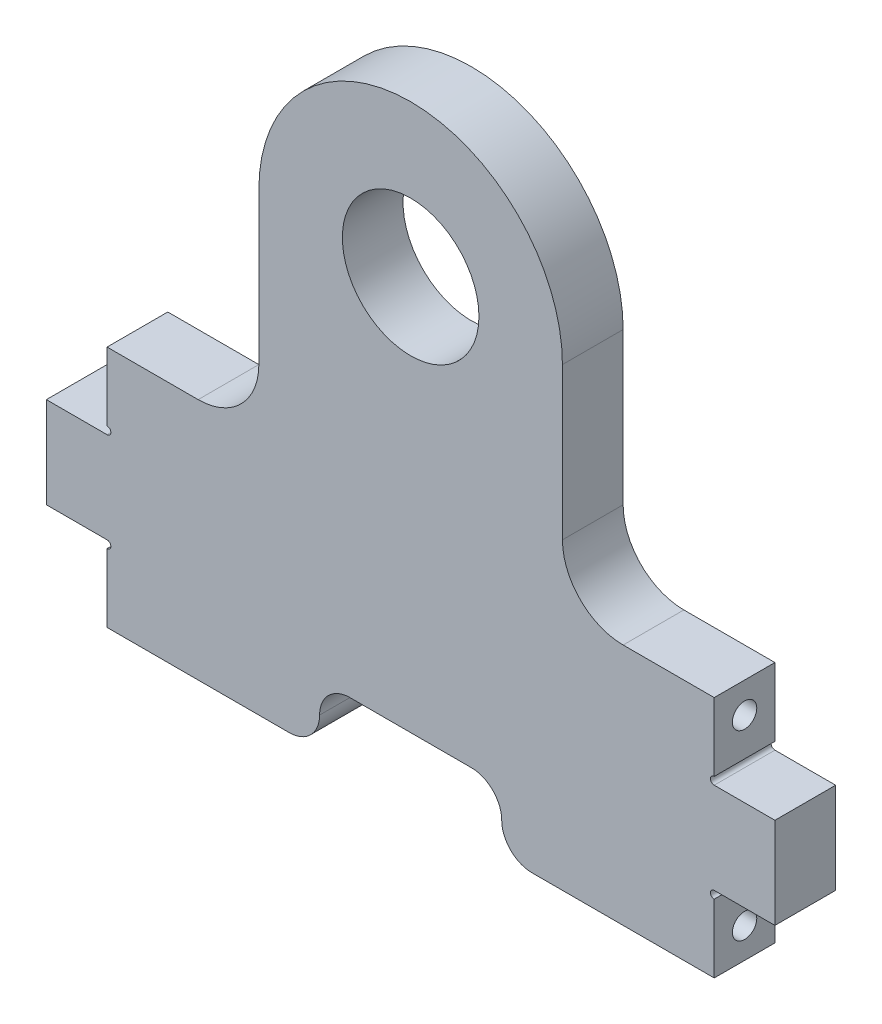
from build123d import *

# Parameters (mm, degrees)
SKETCH1_W                        = 127
SKETCH1_H                        = 152.4
BOSS_EXTRUDE1_DEPTH              = 12.7
SKETCH2_R                        = 14.2875
CUT_EXTRUDE1_DEPTH               = 166.587741092
FILLET1_R                        = 12.7
F_1_4_20_TAPPED_HOLE1_AT_2_COUNT = 2
F_1_4_20_TAPPED_HOLE1_AT_2_PITCH = 38.1
SKETCH5_W                        = 12.7
SKETCH5_H                        = 19.05
BOSS_EXTRUDE2_DEPTH              = 12.7
SKETCH6_R                        = 0.79375
CUT_EXTRUDE2_DEPTH               = 149.649688866
SKETCH7_W                        = 38.1
SKETCH7_H                        = 12.7
CUT_EXTRUDE3_DEPTH               = 149.649688866
FILLET2_START                    = -1
FILLET2_DEPTH                    = 15
FILLET2_2_DEPTH                  = 12.7


with BuildPart() as part:
    # Sketch1 → Boss-Extrude1 (new body)
    with BuildSketch(Plane.XY):
        with Locations((0, 76.2)):
            Rectangle(SKETCH1_W, SKETCH1_H)
    extrude(amount=BOSS_EXTRUDE1_DEPTH)

    # Sketch2 → Cut-Extrude1 (cut, through all)
    with BuildSketch(Plane.XY.offset(12.7)):
        with Locations((0, 95.25)):
            Circle(SKETCH2_R)
        with BuildLine():
            Line((31.75, 95.25), (31.75, 50.8))
            Line((31.75, 50.8), (63.5, 50.8))
            Line((63.5, 50.8), (63.5, 152.4))
            Line((63.5, 152.4), (-63.5, 152.4))
            Line((-63.5, 152.4), (-63.5, 50.8))
            Line((-63.5, 50.8), (-31.75, 50.8))
            Line((-31.75, 50.8), (-31.75, 95.25))
            ThreePointArc((-31.75, 95.25), (0, 127), (31.75, 95.25))
        make_face()
    extrude(amount=-CUT_EXTRUDE1_DEPTH, mode=Mode.SUBTRACT)

    # Fillet1
    fillet1_edges = [part.edges().sort_by_distance(p)[0] for p in [
        (-31.75, 50.8, 6.35),
        (31.75, 50.8, 6.35),
    ]]
    fillet(fillet1_edges, radius=FILLET1_R)

    # Sketch3 → 1/4-20 Tapped Hole1 (revolve, cut)
    with BuildSketch(Plane(origin=(63.5, 44.45, 6.35), x_dir=(0, 0, -1), z_dir=(0, 1, 0))):
        Polygon((0, 0), (0, 18.043816902), (2.5527, 16.51), (2.5527, 0), align=None)
    f_1_4_20_tapped_hole1 = revolve(axis=Axis((69.85, 44.45, 6.35), (-1, 0, 0)), mode=Mode.SUBTRACT)

    # 1/4-20 Tapped Hole1 at 2: 1/4-20 Tapped Hole1 ×2
    with Locations(*[(0, -i * F_1_4_20_TAPPED_HOLE1_AT_2_PITCH, 0) for i in range(1, F_1_4_20_TAPPED_HOLE1_AT_2_COUNT)]):
        add(f_1_4_20_tapped_hole1, mode=Mode.SUBTRACT)

    # Sketch5 → Boss-Extrude2 (add)
    with BuildSketch(Plane(origin=(63.5, 0, 0), x_dir=(0, 0, -1), z_dir=(1, 0, 0))):
        with Locations((-6.35, 25.4)):
            Rectangle(SKETCH5_W, SKETCH5_H)
    boss_extrude2 = extrude(amount=BOSS_EXTRUDE2_DEPTH)

    # Sketch6 → Cut-Extrude2 (cut, through all)
    with BuildSketch(Plane.XY.offset(12.7)):
        with Locations((63.5, 35.71875)):
            Circle(SKETCH6_R)
        with Locations((63.5, 15.08125)):
            Circle(SKETCH6_R)
    cut_extrude2 = extrude(amount=-CUT_EXTRUDE2_DEPTH, mode=Mode.SUBTRACT)

    # Mirror1: 1/4-20 Tapped Hole1, Boss-Extrude2, Cut-Extrude2 across plane
    add(f_1_4_20_tapped_hole1.mirror(Plane(origin=(0, 0, 0), x_dir=(0, 0, 1), z_dir=(1, 0, 0))), mode=Mode.SUBTRACT)
    add(boss_extrude2.mirror(Plane(origin=(0, 0, 0), x_dir=(0, 0, 1), z_dir=(1, 0, 0))))
    add(cut_extrude2.mirror(Plane(origin=(0, 0, 0), x_dir=(0, 0, 1), z_dir=(1, 0, 0))), mode=Mode.SUBTRACT)

    # Mirror1 copy 1 sketch → Mirror1 copy 1 (revolve, cut)
    with BuildSketch(Plane(origin=(-63.5, 6.35, 6.35), x_dir=(0, 0, -1), z_dir=(0, 1, 0))):
        Polygon((0, 0), (0, -18.043816902), (2.5527, -16.51), (2.5527, 0), align=None)
    revolve(axis=Axis((-69.85, 6.35, 6.35), (-1, 0, 0)), mode=Mode.SUBTRACT)

    # Sketch7 → Cut-Extrude3 (cut, through all)
    with BuildSketch(Plane.XY.offset(12.7)):
        with Locations((0, 6.35)):
            Rectangle(SKETCH7_W, SKETCH7_H)
    extrude(amount=-CUT_EXTRUDE3_DEPTH, mode=Mode.SUBTRACT)

    # Fillet2: read off the stored shape, not the designer's step
    # Fillet2 outline → Fillet2 (cut)
    with BuildSketch(Plane.XY.offset(FILLET2_START)):
        with BuildLine():
            Line((19.05, 0), (25.4, 0))
            ThreePointArc((25.4, 0), (20.909871939, 1.859871939), (19.05, 6.35))
            Line((19.05, 6.35), (19.05, 0))
        make_face()
        with BuildLine():
            Line((-19.05, 0), (-19.05, 6.35))
            ThreePointArc((-19.05, 6.35), (-20.909871939, 1.859871939), (-25.4, 0))
            Line((-25.4, 0), (-19.05, 0))
        make_face()
    extrude(amount=FILLET2_DEPTH, mode=Mode.SUBTRACT)

    # Fillet2 2 outline → Fillet2 2 (add)
    with BuildSketch(Plane.XY):
        with BuildLine():
            ThreePointArc((-19.05, 6.35), (-17.190128061, 10.840128061), (-12.7, 12.7))
            Line((-12.7, 12.7), (-19.05, 12.7))
            Line((-19.05, 12.7), (-19.05, 6.35))
        make_face()
        with BuildLine():
            ThreePointArc((12.7, 12.7), (17.190128061, 10.840128061), (19.05, 6.35))
            Line((19.05, 6.35), (19.05, 12.7))
            Line((19.05, 12.7), (12.7, 12.7))
        make_face()
    extrude(amount=FILLET2_2_DEPTH)


solid = part.part
